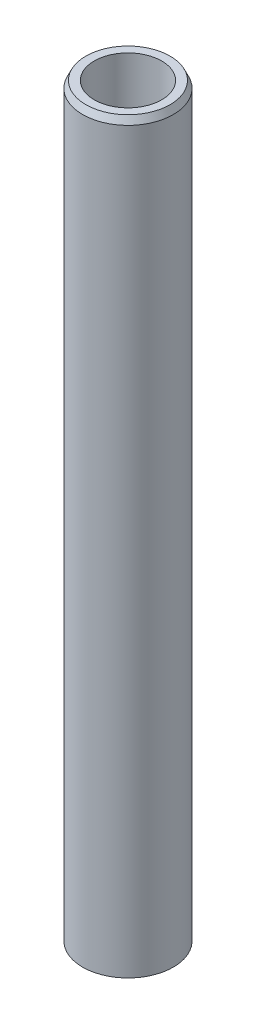
from build123d import *
from OCP.BRepFilletAPI import BRepFilletAPI_MakeChamfer

# Parameters (mm, degrees)
SKETCH1_R           = 12.5
BOSS_EXTRUDE1_DEPTH = 206.330479101
SKETCH2_R           = 9.290356467
CUT_EXTRUDE1_DEPTH  = 208.086374748
CHAMFER1_SIZE       = 1.907036374
CHAMFER1_SIZE2      = 0.893053331


with BuildPart() as part:
    # Sketch1 → Boss-Extrude1 (new body)
    with BuildSketch(Plane(origin=(0, 0, 0), x_dir=(1, 0, 0), z_dir=(0, 1, 0))):
        Circle(SKETCH1_R)
    extrude(amount=BOSS_EXTRUDE1_DEPTH)

    # Sketch2 → Cut-Extrude1 (cut, through all)
    with BuildSketch(Plane(origin=(0, 0, 0), x_dir=(1, 0, 0), z_dir=(0, 1, 0))):
        Circle(SKETCH2_R)
    extrude(amount=CUT_EXTRUDE1_DEPTH, mode=Mode.SUBTRACT)

    # Chamfer1: one chamfer whose edges measure the first distance from different faces: ONE call of the kernel's chamfer builder (chamfer() names one face for all edges)
    chamfer1_edges_1 = [part.edges().sort_by_distance(p)[0] for p in [
        (-12.5, 206.330479101, 0),
    ]]
    chamfer1_side_1 = [part.faces().sort_by_distance(p)[0] for p in [
        (-12.5, 103.165239551, 0),
    ]]
    chamfer1_edges_2 = [part.edges().sort_by_distance(p)[0] for p in [
        (-12.5, 0, 0),
    ]]
    chamfer1_side_2 = [part.faces().sort_by_distance(p)[0] for p in [
        (-12.146446609, 0, 0),
    ]]
    chamfer1 = BRepFilletAPI_MakeChamfer(part.part.solid().wrapped)
    for e in chamfer1_edges_1:
        chamfer1.Add(CHAMFER1_SIZE, CHAMFER1_SIZE2, e.wrapped, chamfer1_side_1[0].wrapped)  # the first distance lies on this face
    for e in chamfer1_edges_2:
        chamfer1.Add(CHAMFER1_SIZE, CHAMFER1_SIZE2, e.wrapped, chamfer1_side_2[0].wrapped)  # the first distance lies on this face
    add(Compound.cast(chamfer1.Shape()), mode=Mode.REPLACE)


solid = part.part
